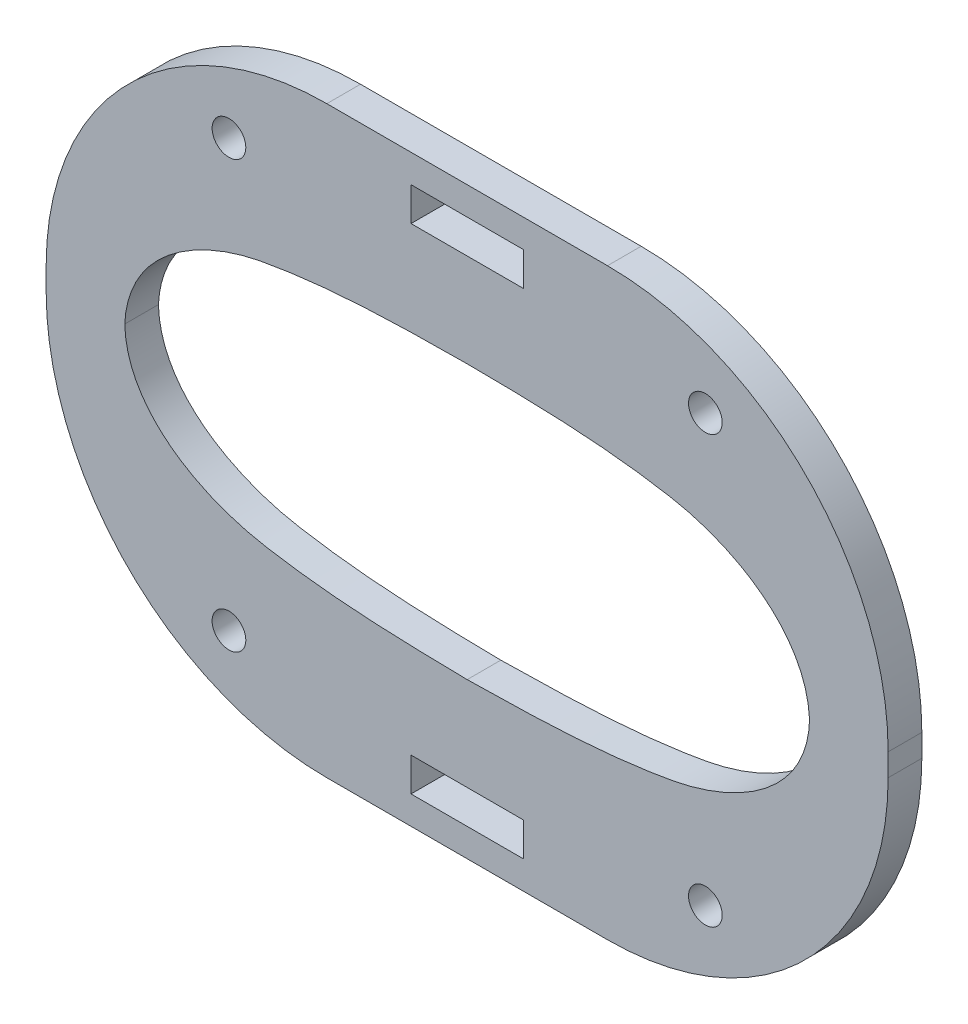
from build123d import *

# Parameters (mm, degrees)
ESBO_O1_R                = 1.5
ESBO_O1_W                = 10
ESBO_O1_H                = 3
RESSALTO_EXTRUS_O1_DEPTH = 3


with BuildPart() as part:
    # Esboço1 → Ressalto-extrusão1 (new body)
    with BuildSketch(Plane.XY):
        with BuildLine():
            Line((12.5, 26), (-12.5, 26))
            ThreePointArc((-12.5, 26), (-30.17766953, 18.67766953), (-37.5, 1))
            Line((-37.5, 1), (-37.5, -1))
            ThreePointArc((-37.5, -1), (-30.17766953, -18.67766953), (-12.5, -26))
            Line((-12.5, -26), (12.5, -26))
            ThreePointArc((12.5, -26), (30.17766953, -18.67766953), (37.5, -1))
            Line((37.5, -1), (37.5, 1))
            ThreePointArc((37.5, 1), (30.17766953, 18.67766953), (12.5, 26))
        make_face()
        with Locations((21.217797887, -19)):
            Circle(ESBO_O1_R, mode=Mode.SUBTRACT)
        with Locations((-21.217797887, -19)):
            Circle(ESBO_O1_R, mode=Mode.SUBTRACT)
        with Locations((21.217797887, 19)):
            Circle(ESBO_O1_R, mode=Mode.SUBTRACT)
        with Locations((-21.217797887, 19)):
            Circle(ESBO_O1_R, mode=Mode.SUBTRACT)
        with Locations((0, -22)):
            Rectangle(ESBO_O1_W, ESBO_O1_H, mode=Mode.SUBTRACT)
        with Locations((0, 22)):
            Rectangle(ESBO_O1_W, ESBO_O1_H, mode=Mode.SUBTRACT)
        with BuildLine():
            add(Edge.make_bspline(
                [(0, 12.17874815), (-6.080256279, 12.142877687), (-12.192312919, 12.029131415), (-24.149431956, 9.871072955), (-30.209358312, 6.115597102), (-30.5, 0)],
                knots=[0, 0, 0, 0, 0.5, 0.5, 1, 1, 1, 1], degree=3))
            add(Edge.make_bspline(
                [(-30.5, 0), (-30.347846139, -6.108949284), (-24.160220297, -9.768272553), (-12.187503007, -11.929185735), (-6.082308436, -12.084117768), (0, -12.17874815)],
                knots=[0, 0, 0, 0, 0.5, 0.5, 1, 1, 1, 1], degree=3))
            add(Edge.make_bspline(
                [(30.5, 0), (30.347846139, -6.108949284), (24.160220297, -9.768272553), (12.187503007, -11.929185735), (6.082308436, -12.084117768), (0, -12.17874815)],
                knots=[0, 0, 0, 0, 0.5, 0.5, 1, 1, 1, 1], degree=3))
            add(Edge.make_bspline(
                [(0, 12.17874815), (6.080256279, 12.142877687), (12.192312919, 12.029131415), (24.149431956, 9.871072955), (30.209358312, 6.115597102), (30.5, 0)],
                knots=[0, 0, 0, 0, 0.5, 0.5, 1, 1, 1, 1], degree=3))
        make_face(mode=Mode.SUBTRACT)
    extrude(amount=RESSALTO_EXTRUS_O1_DEPTH)


solid = part.part
